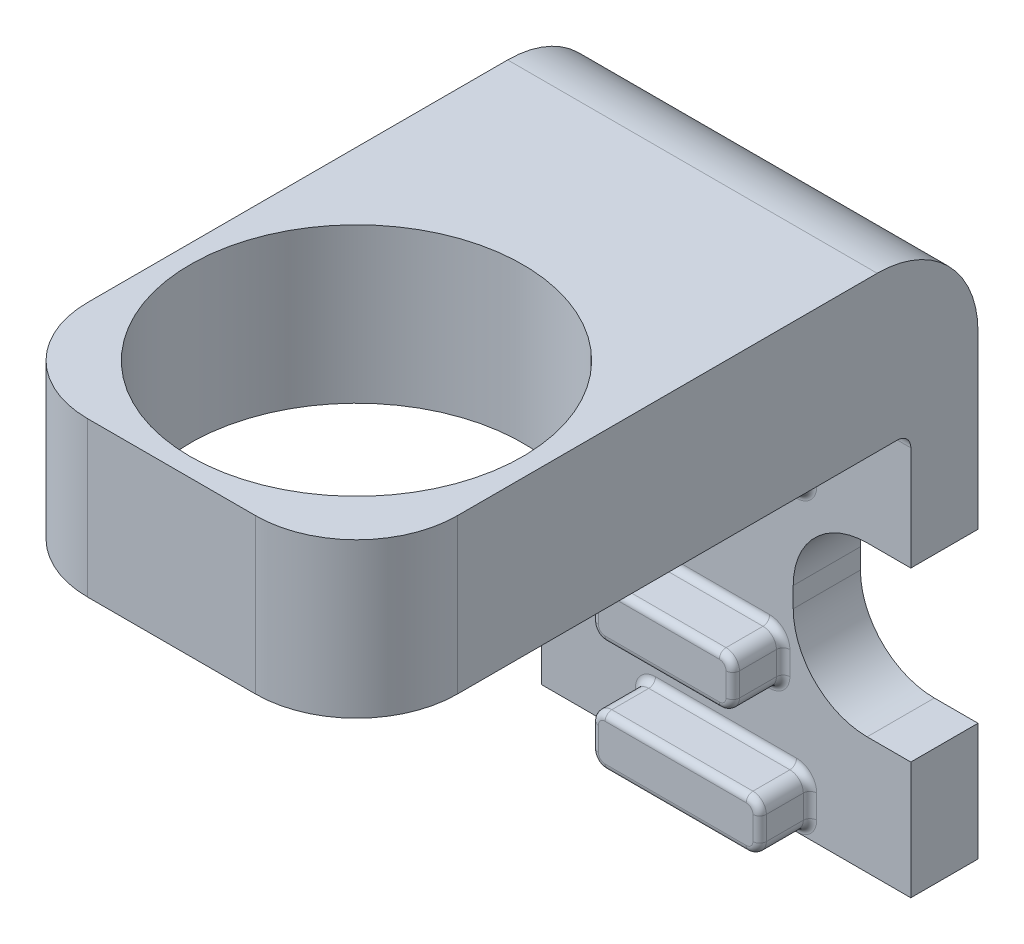
from build123d import *

# Parameters (mm, degrees)
SKETCH1_W           = 11
SKETCH1_H           = 11
SKETCH1_R           = 4.95
SKETCH1_H_2         = 7.5
BOSS_EXTRUDE1_DEPTH = 4.6
SKETCH2_W           = 11
SKETCH2_H           = 2
BOSS_EXTRUDE2_DEPTH = 12
CUT_EXTRUDE1_DEPTH  = 2
FILLET1_R           = 0.4
FILLET2_R           = 3
FILLET3_R           = 3
BOSS_EXTRUDE3_DEPTH = 1.5
FILLET4_R           = 0.2


with BuildPart() as part:
    # Sketch1 → Boss-Extrude1 (new body)
    # profile 1 of 2: a face of its own
    with BuildSketch(Plane(origin=(0, 0, 0), x_dir=(1, 0, 0), z_dir=(0, 1, 0))):
        Rectangle(SKETCH1_W, SKETCH1_H)
        with Locations(Location((0, 0, 0), (0, 0, 270))):
            Circle(SKETCH1_R, mode=Mode.SUBTRACT)
    # profile 2 of 2: a face of its own
    with BuildSketch(Plane(origin=(0, 0, 0), x_dir=(1, 0, 0), z_dir=(0, 1, 0))):
        with Locations((0, 9.25)):
            Rectangle(SKETCH1_W, SKETCH1_H_2)
    extrude(amount=BOSS_EXTRUDE1_DEPTH)

    # Sketch2 → Boss-Extrude2 (add)
    with BuildSketch(Plane.XZ):
        with Locations((0, -12)):
            Rectangle(SKETCH2_W, SKETCH2_H)
    extrude(amount=BOSS_EXTRUDE2_DEPTH)

    # Sketch3 → Cut-Extrude1 (cut)
    with BuildSketch(Plane(origin=(0, 0, -13), x_dir=(-1, 0, 0), z_dir=(0, 0, -1))):
        with BuildLine():
            Line((-5.5, -3.5), (-5.5, -6))
            Line((-5.5, -6), (-2, -6))
            Line((-2, -6), (-2, -5.7))
            ThreePointArc((-2, -5.7), (-2.644365081, -4.144365081), (-4.2, -3.5))
            Line((-4.2, -3.5), (-5.5, -3.5))
        make_face()
        with BuildLine():
            Line((-2, -6), (-5.5, -6))
            Line((-5.5, -6), (-5.5, -8.5))
            Line((-5.5, -8.5), (-4.2, -8.5))
            ThreePointArc((-4.2, -8.5), (-2.644365081, -7.855634919), (-2, -6.3))
            Line((-2, -6.3), (-2, -6))
        make_face()
    extrude(amount=-CUT_EXTRUDE1_DEPTH, mode=Mode.SUBTRACT)

    # Fillet1
    fillet1_edges = [part.edges().sort_by_distance(p)[0] for p in [
        (0, 0, -11),
    ]]
    fillet(fillet1_edges, radius=FILLET1_R)

    # Fillet2
    fillet2_edges = [part.edges().sort_by_distance(p)[0] for p in [
        (0, 4.6, -13),
    ]]
    fillet(fillet2_edges, radius=FILLET2_R)

    # Fillet3
    fillet3_edges = [part.edges().sort_by_distance(p)[0] for p in [
        (-5.5, 2.3, 5.5),
        (5.5, 2.3, 5.5),
    ]]
    fillet(fillet3_edges, radius=FILLET3_R)

    # Sketch4 → Boss-Extrude3 (add)
    with BuildSketch(Plane.XY.offset(-11)):
        with BuildLine():
            Line((-2.1, -1.7), (2.1, -1.7))
            ThreePointArc((2.1, -1.7), (2.382842712, -1.817157288), (2.5, -2.1))
            Line((2.5, -2.1), (2.5, -2.8))
            ThreePointArc((2.5, -2.8), (2.382842712, -3.082842712), (2.1, -3.2))
            Line((2.1, -3.2), (-2.1, -3.2))
            ThreePointArc((-2.1, -3.2), (-2.382842712, -3.082842712), (-2.5, -2.8))
            Line((-2.5, -2.8), (-2.5, -2.1))
            ThreePointArc((-2.5, -2.1), (-2.382842712, -1.817157288), (-2.1, -1.7))
        make_face()
        with BuildLine():
            Line((-2.1, -11.8), (2.1, -11.8))
            ThreePointArc((2.1, -11.8), (2.382842712, -11.682842712), (2.5, -11.4))
            Line((2.5, -11.4), (2.5, -10.7))
            ThreePointArc((2.5, -10.7), (2.382842712, -10.417157288), (2.1, -10.3))
            Line((2.1, -10.3), (-2.1, -10.3))
            ThreePointArc((-2.1, -10.3), (-2.382842712, -10.417157288), (-2.5, -10.7))
            Line((-2.5, -10.7), (-2.5, -11.4))
            ThreePointArc((-2.5, -11.4), (-2.382842712, -11.682842712), (-2.1, -11.8))
        make_face()
        with BuildLine():
            Line((-2.1, -8.5), (1.3, -8.5))
            ThreePointArc((1.3, -8.5), (1.582842712, -8.382842712), (1.7, -8.1))
            Line((1.7, -8.1), (1.7, -7.4))
            ThreePointArc((1.7, -7.4), (1.582842712, -7.117157288), (1.3, -7))
            Line((1.3, -7), (-2.1, -7))
            ThreePointArc((-2.1, -7), (-2.382842712, -7.117157288), (-2.5, -7.4))
            Line((-2.5, -7.4), (-2.5, -8.1))
            ThreePointArc((-2.5, -8.1), (-2.382842712, -8.382842712), (-2.1, -8.5))
        make_face()
    extrude(amount=BOSS_EXTRUDE3_DEPTH)

    # Fillet4
    fillet4_edges = [part.edges().sort_by_distance(p)[0] for p in [
        (-2.5, -7.75, -9.5),
        (-2.5, -7.75, -11),
        (-2.382842712, -7.117157288, -9.5),
        (-2.382842712, -7.117157288, -11),
        (-0.4, -7, -9.5),
        (-0.4, -7, -11),
        (1.582842712, -7.117157288, -9.5),
        (1.582842712, -7.117157288, -11),
        (1.7, -7.75, -9.5),
        (1.7, -7.75, -11),
        (1.582842712, -8.382842712, -9.5),
        (1.582842712, -8.382842712, -11),
        (-0.4, -8.5, -9.5),
        (-0.4, -8.5, -11),
        (-2.382842712, -8.382842712, -9.5),
        (-2.382842712, -8.382842712, -11),
        (-2.5, -2.45, -9.5),
        (-2.5, -2.45, -11),
        (-2.382842712, -1.817157288, -9.5),
        (-2.382842712, -1.817157288, -11),
        (0, -1.7, -9.5),
        (0, -1.7, -11),
        (2.382842712, -1.817157288, -9.5),
        (2.382842712, -1.817157288, -11),
        (2.5, -2.45, -9.5),
        (2.5, -2.45, -11),
        (2.382842712, -3.082842712, -9.5),
        (2.382842712, -3.082842712, -11),
        (0, -3.2, -9.5),
        (0, -3.2, -11),
        (-2.382842712, -3.082842712, -9.5),
        (-2.382842712, -3.082842712, -11),
        (2.5, -11.05, -9.5),
        (2.5, -11.05, -11),
        (2.382842712, -11.682842712, -9.5),
        (2.382842712, -11.682842712, -11),
        (0, -11.8, -9.5),
        (0, -11.8, -11),
        (-2.382842712, -11.682842712, -9.5),
        (-2.382842712, -11.682842712, -11),
        (-2.5, -11.05, -9.5),
        (-2.5, -11.05, -11),
        (-2.382842712, -10.417157288, -9.5),
        (-2.382842712, -10.417157288, -11),
        (0, -10.3, -9.5),
        (0, -10.3, -11),
        (2.382842712, -10.417157288, -9.5),
        (2.382842712, -10.417157288, -11),
    ]]
    fillet(fillet4_edges, radius=FILLET4_R - 0.0001)  # a hair under: the kernel refuses the full size


solid = part.part
